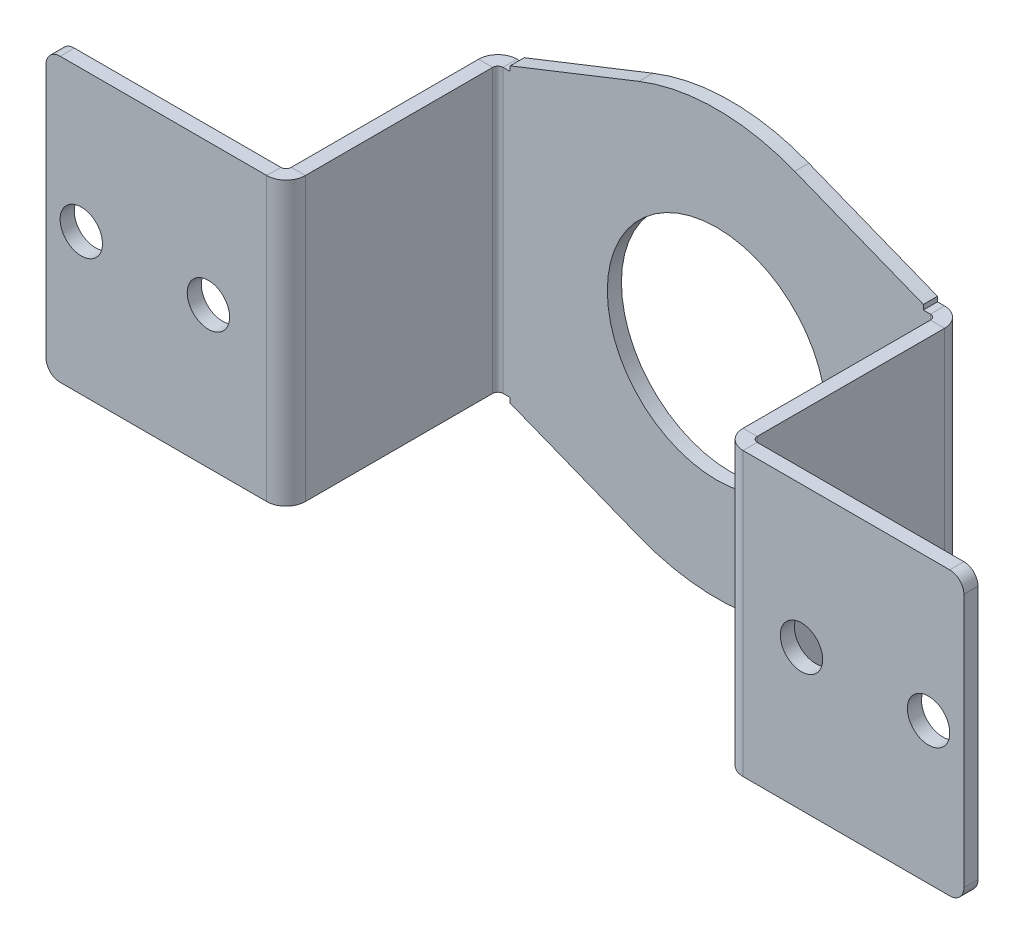
from build123d import *

# Parameters (mm, degrees)
SKETCH1_R                       = 15.5
BASE_FLANGE1_DEPTH              = 2
EDGE_FLANGE1_STRIP_W            = 9.4732
EDGE_FLANGE1_STRIP_H            = 2
EDGE_FLANGE1_STRIP_CUT_DEPTH    = 40
EDGE_FLANGE1_RELIEF_W           = 10.4732
EDGE_FLANGE1_RELIEF_H           = 1
EDGE_FLANGE1_RELIEF_CUT_DEPTH   = 2
EDGE_FLANGE1_STRIP_2_W          = 9.4732
EDGE_FLANGE1_STRIP_2_H          = 2
EDGE_FLANGE1_STRIP_CUT_2_DEPTH  = 40
EDGE_FLANGE1_RELIEF_2_W         = 10.4732
EDGE_FLANGE1_RELIEF_2_H         = 1
EDGE_FLANGE1_RELIEF_CUT_2_DEPTH = 2
EDGE_FLANGE1_DEPTH              = 40
EDGE_FLANGE1_BEND_DEPTH         = 40
EDGE_FLANGE2_STRIP_W            = 9.4732
EDGE_FLANGE2_STRIP_H            = 2
EDGE_FLANGE2_STRIP_CUT_DEPTH    = 40
EDGE_FLANGE2_STRIP_2_W          = 9.4732
EDGE_FLANGE2_STRIP_2_H          = 2
EDGE_FLANGE2_STRIP_CUT_2_DEPTH  = 40
EDGE_FLANGE2_DEPTH              = 40
EDGE_FLANGE2_BEND_DEPTH         = 40
SKETCH17_R                      = 3
CUT_EXTRUDE1_DEPTH              = 10
FILLET1_R                       = 2


# Sheet-metal steps are written as plain solids
with BuildPart() as part:
    # Sketch1 → Base-Flange1 (new body)
    with BuildSketch(Plane.XY):
        with BuildLine():
            Line((-31, 20), (-11.034132012, 27.897095382))
            ThreePointArc((-11.034132012, 27.897095382), (0, 30), (11.034132012, 27.897095382))
            Line((11.034132012, 27.897095382), (31, 20))
            Line((31, 20), (31, -20))
            Line((31, -20), (11.034132012, -27.897095382))
            ThreePointArc((11.034132012, -27.897095382), (0, -30), (-11.034132012, -27.897095382))
            Line((-11.034132012, -27.897095382), (-31, -20))
            Line((-31, -20), (-31, 20))
        make_face()
        Circle(SKETCH1_R, mode=Mode.SUBTRACT)
    extrude(amount=-BASE_FLANGE1_DEPTH)

    # Edge-Flange1 strip (across the edge) → Edge-Flange1 strip cut (cut)
    with BuildSketch(Plane(origin=(-31, 20, 0), x_dir=(1, 0, 0), z_dir=(0, -1, 0))):
        with Locations((-4, -1)):
            Rectangle(EDGE_FLANGE1_STRIP_W, EDGE_FLANGE1_STRIP_H)
    extrude(amount=EDGE_FLANGE1_STRIP_CUT_DEPTH, mode=Mode.SUBTRACT)

    # Edge-Flange1 relief (on the sheet) → Edge-Flange1 relief cut (cut)
    with BuildSketch(Plane(origin=(-30.2634, 20, 0), x_dir=(1, 0, 0), z_dir=(0, 0, 1))):
        with Locations((-4.2366, 0.5)):
            Rectangle(EDGE_FLANGE1_RELIEF_W, EDGE_FLANGE1_RELIEF_H)
        with Locations((-4.2366, -40.5)):
            Rectangle(EDGE_FLANGE1_RELIEF_W, EDGE_FLANGE1_RELIEF_H)
    extrude(amount=-EDGE_FLANGE1_RELIEF_CUT_DEPTH, mode=Mode.SUBTRACT)

    # Edge-Flange1 strip 2 (across the edge) → Edge-Flange1 strip cut 2 (cut)
    with BuildSketch(Plane(origin=(31, -20, 0), x_dir=(-1, 0, 0), z_dir=(0, 1, 0))):
        with Locations((-4, -1)):
            Rectangle(EDGE_FLANGE1_STRIP_2_W, EDGE_FLANGE1_STRIP_2_H)
    extrude(amount=EDGE_FLANGE1_STRIP_CUT_2_DEPTH, mode=Mode.SUBTRACT)

    # Edge-Flange1 relief 2 (on the sheet) → Edge-Flange1 relief cut 2 (cut)
    with BuildSketch(Plane(origin=(30.2634, -20, 0), x_dir=(-1, 0, 0), z_dir=(0, 0, 1))):
        with Locations((-4.2366, 0.5)):
            Rectangle(EDGE_FLANGE1_RELIEF_2_W, EDGE_FLANGE1_RELIEF_2_H)
        with Locations((-4.2366, -40.5)):
            Rectangle(EDGE_FLANGE1_RELIEF_2_W, EDGE_FLANGE1_RELIEF_2_H)
    extrude(amount=-EDGE_FLANGE1_RELIEF_CUT_2_DEPTH, mode=Mode.SUBTRACT)

    # Edge-Flange1 section (across the edge) → Edge-Flange1 (add)
    with BuildSketch(Plane(origin=(-31, 20, 0), x_dir=(1, 0, 0), z_dir=(0, -1, 0))):
        with BuildLine():
            Line((-2, 0.7366), (-2, 28))
            Line((-2, 28), (0, 28))
            Line((0, 28), (0, 0.7366))
            ThreePointArc((0, 0.7366), (0.215745145, 0.215745145), (0.7366, 0))
            Line((0.7366, 0), (0.7366, -2))
            ThreePointArc((0.7366, -2), (-1.198468417, -1.198468417), (-2, 0.7366))
        make_face()
    extrude(amount=EDGE_FLANGE1_DEPTH)

    # Edge-Flange1 section 2 (across the edge) → Edge-Flange1 bend (add)
    with BuildSketch(Plane(origin=(31, -20, 0), x_dir=(-1, 0, 0), z_dir=(0, 1, 0))):
        with BuildLine():
            Line((-2, 0.7366), (-2, 28))
            Line((-2, 28), (0, 28))
            Line((0, 28), (0, 0.7366))
            ThreePointArc((0, 0.7366), (0.215745145, 0.215745145), (0.7366, 0))
            Line((0.7366, 0), (0.7366, -2))
            ThreePointArc((0.7366, -2), (-1.198468417, -1.198468417), (-2, 0.7366))
        make_face()
    extrude(amount=EDGE_FLANGE1_BEND_DEPTH)

    # Edge-Flange2 strip (across the edge) → Edge-Flange2 strip cut (cut)
    with BuildSketch(Plane(origin=(-33, -20, 28), x_dir=(0, 0, -1), z_dir=(0, 1, 0))):
        with Locations((-4, -1)):
            Rectangle(EDGE_FLANGE2_STRIP_W, EDGE_FLANGE2_STRIP_H)
    extrude(amount=EDGE_FLANGE2_STRIP_CUT_DEPTH, mode=Mode.SUBTRACT)

    # Edge-Flange2 strip 2 (across the edge) → Edge-Flange2 strip cut 2 (cut)
    with BuildSketch(Plane(origin=(33, 20, 28), x_dir=(0, 0, -1), z_dir=(0, -1, 0))):
        with Locations((-4, -1)):
            Rectangle(EDGE_FLANGE2_STRIP_2_W, EDGE_FLANGE2_STRIP_2_H)
    extrude(amount=EDGE_FLANGE2_STRIP_CUT_2_DEPTH, mode=Mode.SUBTRACT)

    # Edge-Flange2 section (across the edge) → Edge-Flange2 (add)
    with BuildSketch(Plane(origin=(-33, -20, 28), x_dir=(0, 0, -1), z_dir=(0, 1, 0))):
        with BuildLine():
            Line((-2, 0.7366), (-2, 32))
            Line((-2, 32), (0, 32))
            Line((0, 32), (0, 0.7366))
            ThreePointArc((0, 0.7366), (0.215745145, 0.215745145), (0.7366, 0))
            Line((0.7366, 0), (0.7366, -2))
            ThreePointArc((0.7366, -2), (-1.198468417, -1.198468417), (-2, 0.7366))
        make_face()
    extrude(amount=EDGE_FLANGE2_DEPTH)

    # Edge-Flange2 section 2 (across the edge) → Edge-Flange2 bend (add)
    with BuildSketch(Plane(origin=(33, 20, 28), x_dir=(0, 0, -1), z_dir=(0, -1, 0))):
        with BuildLine():
            Line((-2, 0.7366), (-2, 32))
            Line((-2, 32), (0, 32))
            Line((0, 32), (0, 0.7366))
            ThreePointArc((0, 0.7366), (0.215745145, 0.215745145), (0.7366, 0))
            Line((0.7366, 0), (0.7366, -2))
            ThreePointArc((0.7366, -2), (-1.198468417, -1.198468417), (-2, 0.7366))
        make_face()
    extrude(amount=EDGE_FLANGE2_BEND_DEPTH)

    # Sketch17 → Cut-Extrude1 (cut)
    with BuildSketch(Plane(origin=(0, 0, 28), x_dir=(-1, 0, 0), z_dir=(0, 0, -1))):
        with Locations((60, 0)):
            Circle(SKETCH17_R)
        with Locations((42, 0)):
            Circle(SKETCH17_R)
        with Locations((-60, 0)):
            Circle(SKETCH17_R)
        with Locations((-42, 0)):
            Circle(SKETCH17_R)
    extrude(amount=-CUT_EXTRUDE1_DEPTH, mode=Mode.SUBTRACT)

    # Fillet1
    fillet1_edges = [part.edges().sort_by_distance(p)[0] for p in [
        (-65, -20, 29),
        (-65, 20, 29),
        (65, 20, 29),
        (65, -20, 29),
    ]]
    fillet(fillet1_edges, radius=FILLET1_R)


solid = part.part
